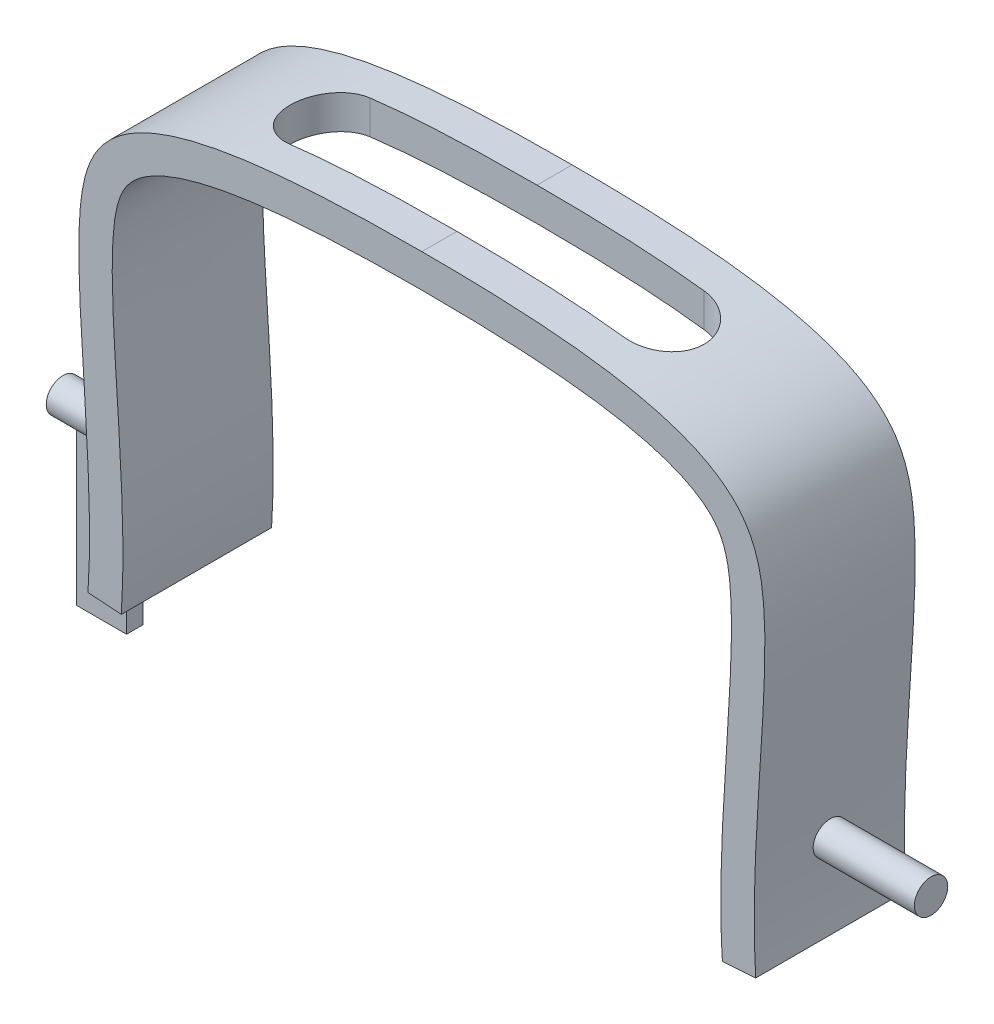
from build123d import *

# Parameters (mm, degrees)
MAIN_BODY_DEPTH              = 5.715
SLOT_FOR_JOYSTICK_DEPTH      = 127
SLOT_FOR_JOYSTICK_DEPTH_BACK = 127
SKETCH5_R                    = 1.27
NIBBLE_TWO_DEPTH             = 7.62
NIBBLE_TWO_DIRECTION_2_REACH = 64.831
SKETCH6_R                    = 1.27
NIBBLE_ONE_DEPTH             = 7.62
NIBBLE_ONE_DIRECTION_2_REACH = 70.617
SKETCH7_W                    = 3.81
SKETCH7_H                    = 1.27
FLAG_DEPTH                   = 12.7


with BuildPart() as part:
    # Sketch3 → main body (new, symmetric)
    with BuildSketch(Plane.XY):
        with BuildLine():
            Line((-25.392608442, 0.412757998), (-22.858784474, 0.235737941))
            add(Edge.make_bspline(
                [(-22.858784474, 0.235737941), (-22.207297233, 9.560974923), (-24.857071241, 24.747691028), (-20.428557404, 32.25929775), (-9.259543282, 33.02), (0, 33.02)],
                knots=[0, 0, 0, 0, 0.433889372, 0.533889372, 1, 1, 1, 1], degree=3))
            add(Edge.make_bspline(
                [(22.858784474, 0.235737941), (22.207297233, 9.560974923), (24.857071241, 24.747691028), (20.428557404, 32.25929775), (9.259543282, 33.02), (0, 33.02)],
                knots=[0, 0, 0, 0, 0.433889372, 0.533889372, 1, 1, 1, 1], degree=3))
            Line((22.858784474, 0.235737941), (25.392608442, 0.412757998))
            add(Edge.make_bspline(
                [(0, 35.56), (1.254311658, 35.56), (3.775402004, 35.537283686), (8.716263904, 35.364909913), (13.364408191, 34.95031307), (17.451619904, 34.157368544), (20.19143925, 33.318161822), (22.191145094, 32.324605138), (23.581645529, 31.247774677), (24.510467356, 30.223143514), (25.221212474, 28.976764345), (25.816104763, 27.16552201), (26.097899373, 24.685629746), (26.104154518, 21.203211789), (25.906005631, 17.271643308), (25.62301776, 13.038150403), (25.363639259, 8.672591167), (25.255928833, 5.092554321), (25.287282478, 2.342948324), (25.34716307, 1.063252489), (25.392608442, 0.412757998)],
                knots=[0, 0, 0, 0, 0.0625, 0.125, 0.25, 0.3125, 0.375, 0.4375, 0.46875, 0.5, 0.53125, 0.5625, 0.625, 0.6875, 0.75, 0.8125, 0.875, 0.9375, 0.96875, 1, 1, 1, 1], degree=3))
            add(Edge.make_bspline(
                [(-25.392608442, 0.412757998), (-25.34716307, 1.063252489), (-25.287282478, 2.342948324), (-25.255928833, 5.092554321), (-25.363639259, 8.672591167), (-25.62301776, 13.038150403), (-25.906005631, 17.271643308), (-26.104154518, 21.203211789), (-26.097899373, 24.685629746), (-25.816104763, 27.16552201), (-25.221212474, 28.976764345), (-24.510467356, 30.223143514), (-23.581645529, 31.247774677), (-22.191145094, 32.324605138), (-20.19143925, 33.318161822), (-17.451619904, 34.157368544), (-13.364408191, 34.95031307), (-8.716263904, 35.364909913), (-3.775402004, 35.537283686), (-1.254311658, 35.56), (0, 35.56)],
                knots=[0, 0, 0, 0, 0.03125, 0.0625, 0.125, 0.1875, 0.25, 0.3125, 0.375, 0.4375, 0.46875, 0.5, 0.53125, 0.5625, 0.625, 0.6875, 0.75, 0.875, 0.9375, 1, 1, 1, 1], degree=3))
        make_face()
    extrude(amount=MAIN_BODY_DEPTH, both=True)

    # Sketch4 → slot for joystick (cut, two sides: drawn at the far end of the back side and taken through both)
    with BuildSketch(Plane(origin=(0, 35.56, 0), x_dir=(1, 0, 0), z_dir=(0, 1, 0)).offset(-SLOT_FOR_JOYSTICK_DEPTH_BACK)):
        with BuildLine():
            Line((-12.7, 3.048), (12.7, 3.048))
            ThreePointArc((12.7, 3.048), (15.748, 0), (12.7, -3.048))
            Line((12.7, -3.048), (-12.7, -3.048))
            ThreePointArc((-12.7, -3.048), (-15.748, 0), (-12.7, 3.048))
        make_face()
    extrude(amount=SLOT_FOR_JOYSTICK_DEPTH + SLOT_FOR_JOYSTICK_DEPTH_BACK, mode=Mode.SUBTRACT)

    # Sketch5 → nibble two (add)
    with BuildSketch(Plane(origin=(25.392608442, 0, 0), x_dir=(0, 0, -1), z_dir=(1, 0, 0))):
        with Locations((0, 6.762757998)):
            Circle(SKETCH5_R)
    extrude(amount=NIBBLE_TWO_DEPTH)

    # Sketch5 → nibble two direction 2 (add, up to next)
    with BuildSketch(Plane(origin=(25.392608442, 0, 0), x_dir=(0, 0, -1), z_dir=(1, 0, 0)), mode=Mode.PRIVATE) as nibble_two_direction_2_sk1:
        with Locations((0, 6.762757998)):
            Circle(SKETCH5_R)
    nibble_two_direction_2_tool1 = extrude(nibble_two_direction_2_sk1.sketch, amount=-NIBBLE_TWO_DIRECTION_2_REACH, mode=Mode.PRIVATE) - part.part
    add(nibble_two_direction_2_tool1.solids().sort_by_distance((25.392608, 6.762758, 0))[0])

    # Sketch6 → nibble one (add)
    with BuildSketch(Plane(origin=(-25.392608442, 0, 0), x_dir=(0, 0, -1), z_dir=(1, 0, 0))):
        with Locations((0, 6.762757998)):
            Circle(SKETCH6_R)
    extrude(amount=-NIBBLE_ONE_DEPTH)

    # Sketch6 → nibble one direction 2 (add, up to next)
    with BuildSketch(Plane(origin=(-25.392608442, 0, 0), x_dir=(0, 0, -1), z_dir=(1, 0, 0)), mode=Mode.PRIVATE) as nibble_one_direction_2_sk1:
        with Locations((0, 6.762757998)):
            Circle(SKETCH6_R)
    nibble_one_direction_2_tool1 = extrude(nibble_one_direction_2_sk1.sketch, amount=NIBBLE_ONE_DIRECTION_2_REACH, mode=Mode.PRIVATE) - part.part
    add(nibble_one_direction_2_tool1.solids().sort_by_distance((-25.392608, 6.762758, 0))[0])

    # Sketch7 → flag (add)
    with BuildSketch(Plane(origin=(0, 6.762757998, 0), x_dir=(1, 0, 0), z_dir=(0, 1, 0))):
        with Locations((-29.429266279, -0.015489835)):
            Rectangle(SKETCH7_W, SKETCH7_H)
    extrude(amount=-FLAG_DEPTH)


solid = part.part
